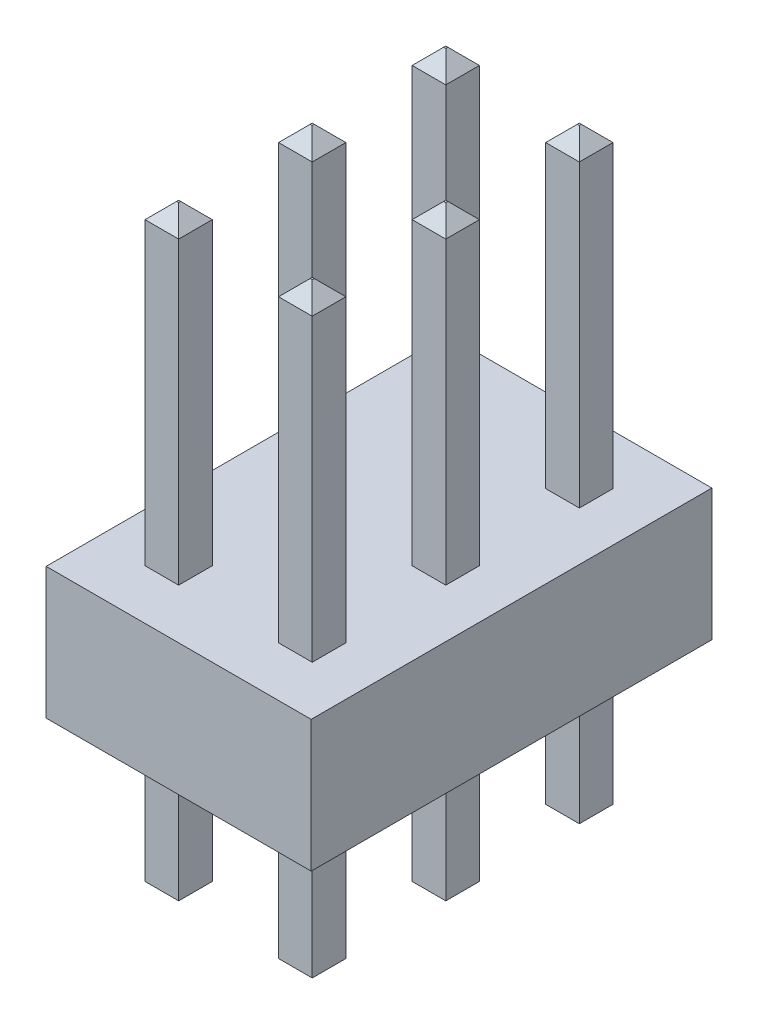
from build123d import *

# Parameters (mm, degrees)
SKIZZE1_W                       = 5.04
SKIZZE1_H                       = 2.5
AUFSATZ_LINEAR_AUSTRAGEN1_DEPTH = 7.62
SKIZZE2_W                       = 0.64
SKIZZE2_H                       = 0.64
AUFSATZ_LINEAR_AUSTRAGEN2_DEPTH = 6
FASE1_SIZE                      = 0.3
SKIZZE3_W                       = 0.64
SKIZZE3_H                       = 0.64
AUFSATZ_LINEAR_AUSTRAGEN3_DEPTH = 3
FASE2_SIZE                      = 0.3


with BuildPart() as part:
    # Skizze1 → Aufsatz-Linear austragen1 (new body)
    with BuildSketch(Plane.XY):
        with Locations((2.52, 1.25)):
            Rectangle(SKIZZE1_W, SKIZZE1_H)
    extrude(amount=AUFSATZ_LINEAR_AUSTRAGEN1_DEPTH)

    # Skizze2 → Aufsatz-Linear austragen2 (add)
    with BuildSketch(Plane(origin=(0, 2.5, 0), x_dir=(1, 0, 0), z_dir=(0, 1, 0))):
        with Locations((3.79, -1.27)):
            Rectangle(SKIZZE2_W, SKIZZE2_H)
        with Locations((1.25, -1.27)):
            Rectangle(SKIZZE2_W, SKIZZE2_H)
        with Locations((1.25, -3.81)):
            Rectangle(SKIZZE2_W, SKIZZE2_H)
        with Locations((3.79, -3.81)):
            Rectangle(SKIZZE2_W, SKIZZE2_H)
        with Locations((1.25, -6.35)):
            Rectangle(SKIZZE2_W, SKIZZE2_H)
        with Locations((3.79, -6.35)):
            Rectangle(SKIZZE2_W, SKIZZE2_H)
    extrude(amount=AUFSATZ_LINEAR_AUSTRAGEN2_DEPTH)

    # Fase1
    fase1_edges = [part.edges().sort_by_distance(p)[0] for p in [
        (1.57, 8.5, 6.35),
        (1.25, 8.5, 6.67),
        (0.93, 8.5, 6.35),
        (1.25, 8.5, 6.03),
        (4.11, 8.5, 6.35),
        (3.79, 8.5, 6.67),
        (3.47, 8.5, 6.35),
        (3.79, 8.5, 6.03),
        (4.11, 8.5, 3.81),
        (3.79, 8.5, 4.13),
        (3.79, 8.5, 3.49),
        (3.47, 8.5, 3.81),
        (1.57, 8.5, 3.81),
        (1.25, 8.5, 4.13),
        (0.93, 8.5, 3.81),
        (1.25, 8.5, 3.49),
        (1.57, 8.5, 1.27),
        (1.25, 8.5, 1.59),
        (0.93, 8.5, 1.27),
        (1.25, 8.5, 0.95),
        (3.79, 8.5, 1.59),
        (3.47, 8.5, 1.27),
        (3.79, 8.5, 0.95),
        (4.11, 8.5, 1.27),
    ]]
    chamfer(fase1_edges, length=FASE1_SIZE)

    # Skizze3 → Aufsatz-Linear austragen3 (add)
    with BuildSketch(Plane.XZ):
        with Locations((1.25, 1.27)):
            Rectangle(SKIZZE3_W, SKIZZE3_H)
        with Locations((3.79, 1.27)):
            Rectangle(SKIZZE3_W, SKIZZE3_H)
        with Locations((1.25, 3.81)):
            Rectangle(SKIZZE3_W, SKIZZE3_H)
        with Locations((3.79, 3.81)):
            Rectangle(SKIZZE3_W, SKIZZE3_H)
        with Locations((1.25, 6.35)):
            Rectangle(SKIZZE3_W, SKIZZE3_H)
        with Locations((3.79, 6.35)):
            Rectangle(SKIZZE3_W, SKIZZE3_H)
    extrude(amount=AUFSATZ_LINEAR_AUSTRAGEN3_DEPTH)

    # Fase2
    fase2_edges = [part.edges().sort_by_distance(p)[0] for p in [
        (1.25, -3, 3.49),
        (0.93, -3, 3.81),
        (1.25, -3, 4.13),
        (1.57, -3, 3.81),
        (1.25, -3, 6.03),
        (0.93, -3, 6.35),
        (1.25, -3, 6.67),
        (1.57, -3, 6.35),
        (3.79, -3, 6.67),
        (3.47, -3, 6.35),
        (3.79, -3, 6.03),
        (4.11, -3, 6.35),
        (3.79, -3, 3.49),
        (3.47, -3, 3.81),
        (3.79, -3, 4.13),
        (4.11, -3, 3.81),
        (1.25, -3, 0.95),
        (0.93, -3, 1.27),
        (1.25, -3, 1.59),
        (1.57, -3, 1.27),
        (3.47, -3, 1.27),
        (3.79, -3, 1.59),
        (3.79, -3, 0.95),
        (4.11, -3, 1.27),
    ]]
    chamfer(fase2_edges, length=FASE2_SIZE)


solid = part.part
